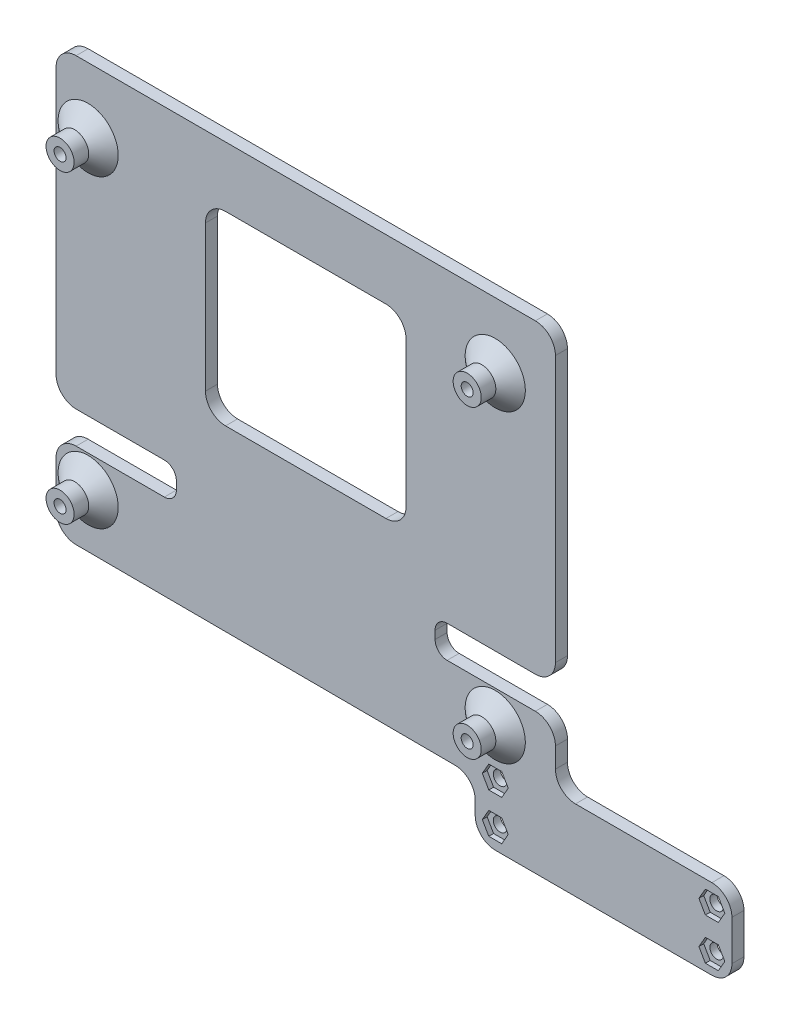
from build123d import *

# Parameters (mm, degrees)
EXTRUDE_1_OUTLINE_R = 1.7
EXTRUDE_1_DEPTH     = 3
FILLET_1_R          = 3
FILLET_2_R          = 5
SKETCH_2_R          = 3.5
EXTRUDE_2_DEPTH     = 7
CHAMFER_1_SIZE      = 4
CHAMFER_1_SIZE2     = 3.356398525
SKETCH_3_R          = 1.6
CUT_EXTRUDE_1_DEPTH = 50
CUT_EXTRUDE_2_DEPTH = 1.2
CUT_EXTRUDE_3_DEPTH = 10
FILLET_3_R          = 5
EXTRUDE_START       = -10
SKETCH_6_R          = 2.5
SKETCH_6_R_2        = 1.5
EXTRUDE_1_2_DEPTH   = 10


# Read off the part's stored shape, not the designer's step: 보스-돌출1
with BuildPart() as part:
    # Extrude 1 outline → Extrude 1 (new body)
    with BuildSketch(Plane.XY):
        Polygon((61.805886205, -13.571810541), (61.805886205, 6.428189459), (17.805886205, 6.428189459), (17.805886205, 21.428189459), (-12.194113795, 21.428189459), (-12.194113795, 29.428189459), (17.805886205, 29.428189459), (17.805886205, 105.728189459), (-106.694113795, 105.728189459), (-106.694113795, 29.428189459), (-76.694113795, 29.428189459), (-76.694113795, 21.428189459), (-106.694113795, 21.428189459), (-106.694113795, 0.157968071), (-2.194113795, -0.252198443), (-2.194113795, -13.571810541), align=None)
        with Locations((-98.694113795, 13.428189459)):
            Circle(EXTRUDE_1_OUTLINE_R, mode=Mode.SUBTRACT)
        with Locations((2.805886205, -8.571810541)):
            Circle(EXTRUDE_1_OUTLINE_R, mode=Mode.SUBTRACT)
        with Locations((2.805886205, 1.428189459)):
            Circle(EXTRUDE_1_OUTLINE_R, mode=Mode.SUBTRACT)
        with Locations((2.805886205, 13.428189459)):
            Circle(EXTRUDE_1_OUTLINE_R, mode=Mode.SUBTRACT)
        with Locations((56.805886205, -8.979991995)):
            Circle(EXTRUDE_1_OUTLINE_R, mode=Mode.SUBTRACT)
        with Locations((56.805886205, 1.428189459)):
            Circle(EXTRUDE_1_OUTLINE_R, mode=Mode.SUBTRACT)
        with Locations((-98.694113795, 89.428189459)):
            Circle(EXTRUDE_1_OUTLINE_R, mode=Mode.SUBTRACT)
        with Locations((2.805886205, 89.428189459)):
            Circle(EXTRUDE_1_OUTLINE_R, mode=Mode.SUBTRACT)
    extrude(amount=EXTRUDE_1_DEPTH)

    # 필렛1
    fillet_1_edges = [part.edges().sort_by_distance(p)[0] for p in [
        (-76.694113795, 21.428189459, 1.5),
        (-76.694113795, 29.428189459, 1.5),
        (-12.194113795, 29.428189459, 1.5),
        (-12.194113795, 21.428189459, 1.5),
    ]]
    fillet(fillet_1_edges, radius=FILLET_1_R)

    # 필렛2
    fillet_2_edges = [part.edges().sort_by_distance(p)[0] for p in [
        (61.805886205, 6.428189459, 1.5),
        (61.805886205, -13.571810541, 1.5),
        (-2.194113795, -13.571810541, 1.5),
        (-2.194113795, -0.252198443, 1.5),
        (-106.694113795, 0.157968071, 1.5),
        (-106.694113795, 21.428189459, 1.5),
        (-106.694113795, 29.428189459, 1.5),
        (-106.694113795, 105.728189459, 1.5),
        (17.805886205, 105.728189459, 1.5),
        (17.805886205, 29.428189459, 1.5),
        (17.805886205, 21.428189459, 1.5),
        (17.805886205, 6.428189459, 1.5),
    ]]
    fillet(fillet_2_edges, radius=FILLET_2_R)

    # 스케치2 → 보스-돌출2 (add)
    with BuildSketch(Plane.XY.offset(3)):
        with Locations((-98.694113795, 89.428189459)):
            Circle(SKETCH_2_R)
        with Locations((2.805886205, 89.428189459)):
            Circle(SKETCH_2_R)
        with Locations((-98.694113795, 13.428189459)):
            Circle(SKETCH_2_R)
        with Locations((2.805886205, 13.428189459)):
            Circle(SKETCH_2_R)
    extrude(amount=EXTRUDE_2_DEPTH)

    # 모따기1
    chamfer_1_edges = [part.edges().sort_by_distance(p)[0] for p in [
        (-102.194113795, 89.428189459, 3),
        (-0.694113795, 89.428189459, 3),
        (-102.194113795, 13.428189459, 3),
        (-0.694113795, 13.428189459, 3),
    ]]
    chamfer_1_side = [part.faces().sort_by_distance(p)[0] for p in [
        (-38.126255905, 49.180268575, 3),
    ]]
    chamfer(chamfer_1_edges, length=CHAMFER_1_SIZE, length2=CHAMFER_1_SIZE2, reference=chamfer_1_side[0])

    # 스케치3 → 컷-돌출1 (cut)
    with BuildSketch(Plane(origin=(0, 0, 0), x_dir=(-1, 0, 0), z_dir=(0, 0, -1))):
        with Locations(Location((-2.805886205, 89.428189459, 0), (0, 0, 180))):
            Circle(SKETCH_3_R)
        with Locations(Location((-2.805886205, 13.428189459, 0), (0, 0, 180))):
            Circle(SKETCH_3_R)
        with Locations(Location((98.694113795, 13.428189459, 0), (0, 0, 180))):
            Circle(SKETCH_3_R)
        with Locations(Location((98.694113795, 89.428189459, 0), (0, 0, 180))):
            Circle(SKETCH_3_R)
    extrude(amount=-CUT_EXTRUDE_1_DEPTH, mode=Mode.SUBTRACT)

    # 스케치4 → 컷-돌출2 (cut)
    with BuildSketch(Plane.XY.offset(3)):
        Polygon((6.039047712, 1.428189459), (4.422466959, 4.228189459), (1.189305451, 4.228189459), (-0.427275303, 1.428189459), (1.189305451, -1.371810541), (4.422466959, -1.371810541), align=None)
        Polygon((6.039047712, -8.571810541), (4.422466959, -5.771810541), (1.189305451, -5.771810541), (-0.427275303, -8.571810541), (1.189305451, -11.371810541), (4.422466959, -11.371810541), align=None)
        Polygon((53.572724697, 1.428189459), (55.189305451, -1.371810541), (58.422466959, -1.371810541), (60.039047712, 1.428189459), (58.422466959, 4.228189459), (55.189305451, 4.228189459), align=None)
        Polygon((53.572724697, -8.979991995), (55.189305451, -11.779991995), (58.422466959, -11.779991995), (60.039047712, -8.979991995), (58.422466959, -6.179991995), (55.189305451, -6.179991995), align=None)
    extrude(amount=-CUT_EXTRUDE_2_DEPTH, mode=Mode.SUBTRACT)

    # 스케치5 → 컷-돌출3 (cut)
    with BuildSketch(Plane.XY.offset(3)):
        Polygon((-44.444113795, 90.728189459), (-44.444113795, 52.86409473), (-34.510431855, 44.428189459), (-19.444113795, 44.428189459), (-19.444113795, 90.728189459), align=None)
        Polygon((-69.444113795, 90.728189459), (-69.444113795, 74.094654862), (-44.444113795, 52.86409473), (-44.444113795, 90.728189459), align=None)
        Polygon((-44.444113795, 52.86409473), (-69.444113795, 74.094654862), (-69.444113795, 44.428189459), (-34.510431855, 44.428189459), align=None)
    extrude(amount=-CUT_EXTRUDE_3_DEPTH, mode=Mode.SUBTRACT)

    # 필렛3
    fillet_3_edges = [part.edges().sort_by_distance(p)[0] for p in [
        (-19.444113795, 90.728189459, 1.5),
        (-19.444113795, 44.428189459, 1.5),
        (-69.444113795, 44.428189459, 1.5),
        (-69.444113795, 90.728189459, 1.5),
    ]]
    fillet(fillet_3_edges, radius=FILLET_3_R)

    # 스케치6 → Extrude 1 2 (add)
    # profile 1 of 4: a face of its own
    with BuildSketch(Plane(origin=(0, 0, 0), x_dir=(-1, 0, 0), z_dir=(0, 0, -1)).offset(EXTRUDE_START)):
        with Locations((-2.805886205, 89.428189459)):
            Circle(SKETCH_6_R)
        with Locations((-2.805886205, 89.428189459)):
            Circle(SKETCH_6_R_2, mode=Mode.SUBTRACT)
    # profile 2 of 4: a face of its own
    with BuildSketch(Plane(origin=(0, 0, 0), x_dir=(-1, 0, 0), z_dir=(0, 0, -1)).offset(EXTRUDE_START)):
        with Locations((-2.805886205, 13.428189459)):
            Circle(SKETCH_6_R)
        with Locations((-2.805886205, 13.428189459)):
            Circle(SKETCH_6_R_2, mode=Mode.SUBTRACT)
    # profile 3 of 4: a face of its own
    with BuildSketch(Plane(origin=(0, 0, 0), x_dir=(-1, 0, 0), z_dir=(0, 0, -1)).offset(EXTRUDE_START)):
        with Locations((98.694113795, 13.428189459)):
            Circle(SKETCH_6_R)
        with Locations((98.694113795, 13.428189459)):
            Circle(SKETCH_6_R_2, mode=Mode.SUBTRACT)
    # profile 4 of 4: a face of its own
    with BuildSketch(Plane(origin=(0, 0, 0), x_dir=(-1, 0, 0), z_dir=(0, 0, -1)).offset(EXTRUDE_START)):
        with Locations((98.694113795, 89.428189459)):
            Circle(SKETCH_6_R)
        with Locations((98.694113795, 89.428189459)):
            Circle(SKETCH_6_R_2, mode=Mode.SUBTRACT)
    extrude(amount=EXTRUDE_1_2_DEPTH)


solid = part.part
